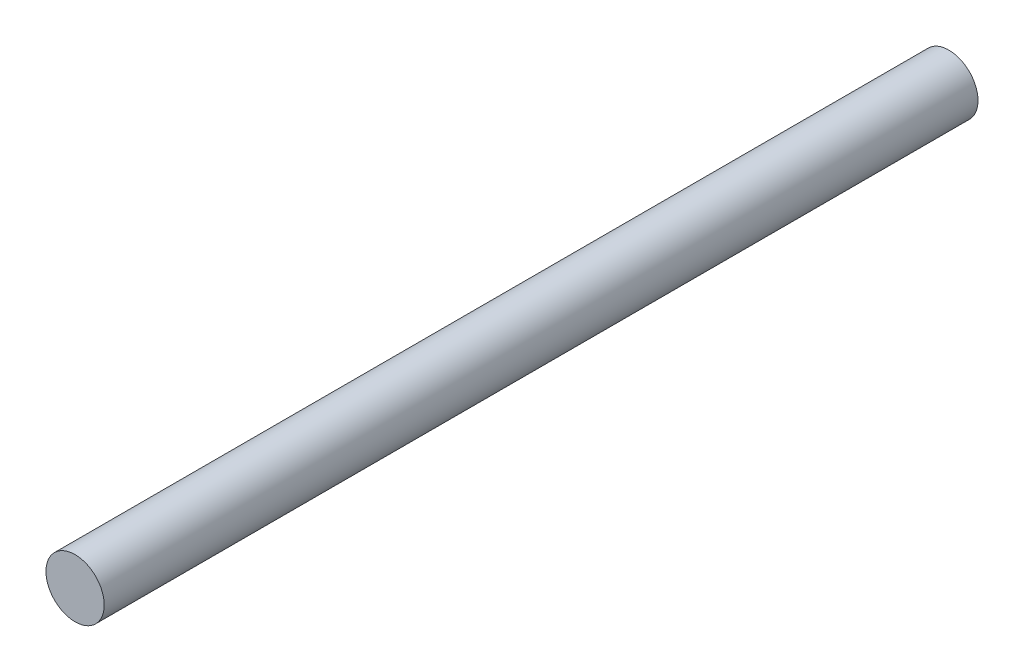
from build123d import *

# Parameters (mm, degrees)
SKETCH_3_R      = 4
EXTRUDE_1_DEPTH = 60


with BuildPart() as part:
    # 草图3 → 凸台-拉伸1 (new, symmetric)
    with BuildSketch(Plane.XY):
        Circle(SKETCH_3_R)
    extrude(amount=EXTRUDE_1_DEPTH, both=True)


solid = part.part
